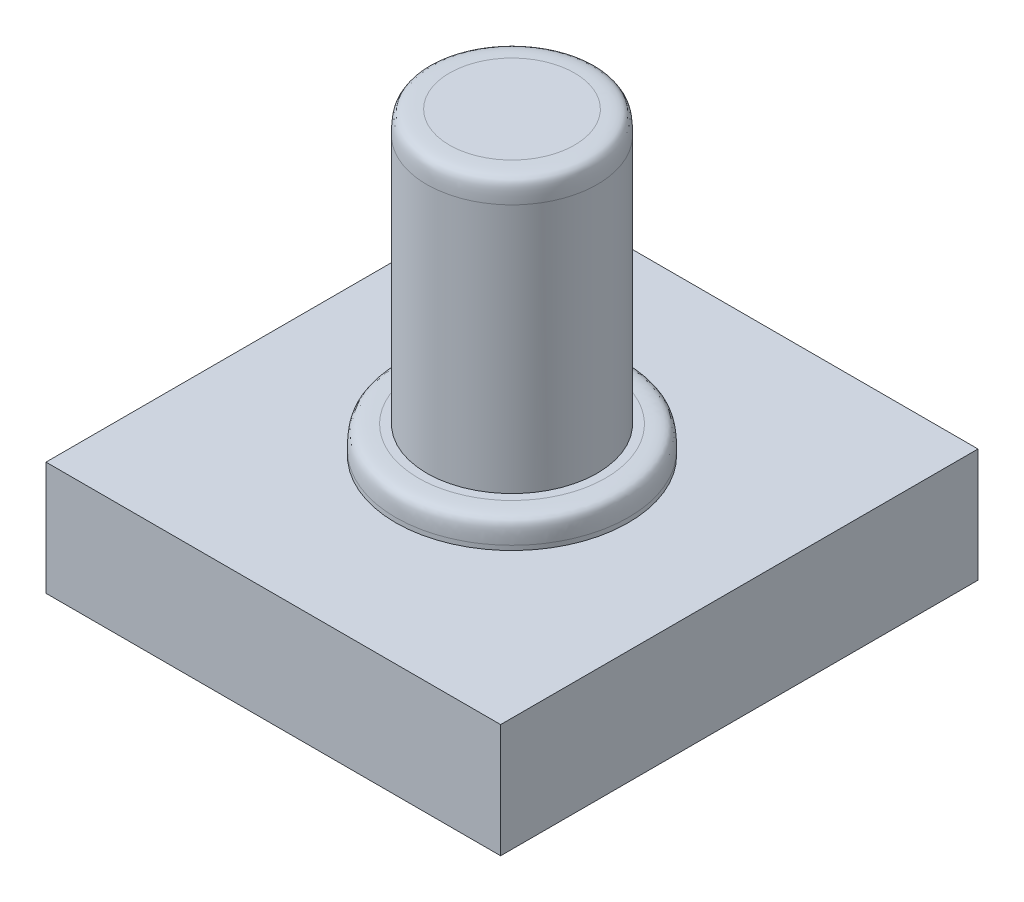
from build123d import *

# Parameters (mm, degrees)
SKETCH_2_W      = 10
SKETCH_2_H      = 10.5
EXTRUDE_1_DEPTH = 2.5
SKETCH_3_R      = 2.56
EXTRUDE_2_DEPTH = 0.6
FILLET_1_SIZE   = 0.5
SKETCH_4_R      = 1.875
EXTRUDE_3_DEPTH = 6
FILLET_2_SIZE   = 0.5


with BuildPart() as part:
    # Эскиз2 → Бобышка-Вытянуть1 (new body)
    with BuildSketch(Plane(origin=(0, 0, 0), x_dir=(1, 0, 0), z_dir=(0, 1, 0))):
        Rectangle(SKETCH_2_W, SKETCH_2_H)
    extrude(amount=EXTRUDE_1_DEPTH)

    # Эскиз3 → Бобышка-Вытянуть2 (add)
    with BuildSketch(Plane(origin=(0, 2.5, 0), x_dir=(1, 0, 0), z_dir=(0, 1, 0))):
        with Locations(Location((0, 0, 0), (0, 0, 270))):
            Circle(SKETCH_3_R)
    extrude(amount=EXTRUDE_2_DEPTH)

    # Скругление1
    # a fillet whose section is not a circle: 0.5 mm, written as the material it takes off along each edge
    with BuildSketch(Plane(origin=(0, 3.1, 0), x_dir=(0, 0, 1), z_dir=(-1, 0, 0))) as fillet_1_piece_1:
        with BuildLine():
            Bezier((2.56, -FILLET_1_SIZE), (2.56, 0), (2.56 - FILLET_1_SIZE, 0), weights=[1, 2.333333333, 1])
            Line((2.56 - FILLET_1_SIZE, 0), (2.56, 0))
            Line((2.56, 0), (2.56, -FILLET_1_SIZE))
        make_face()
    revolve(axis=Axis((0, 3.1, 0), (0, 1, 0)), mode=Mode.SUBTRACT)

    # Эскиз4 → Бобышка-Вытянуть3 (add)
    with BuildSketch(Plane(origin=(0, 3.1, 0), x_dir=(1, 0, 0), z_dir=(0, 1, 0))):
        with Locations(Location((0, 0, 0), (0, 0, 270))):
            Circle(SKETCH_4_R)
    extrude(amount=EXTRUDE_3_DEPTH)

    # Скругление2
    # a fillet whose section is not a circle: 0.5 mm, written as the material it takes off along each edge
    with BuildSketch(Plane(origin=(0, 9.1, 0), x_dir=(0, 0, 1), z_dir=(-1, 0, 0))) as fillet_2_piece_1:
        with BuildLine():
            Bezier((1.875, -FILLET_2_SIZE), (1.875, 0), (1.875 - FILLET_2_SIZE, 0), weights=[1, 2.333333333, 1])
            Line((1.875 - FILLET_2_SIZE, 0), (1.875, 0))
            Line((1.875, 0), (1.875, -FILLET_2_SIZE))
        make_face()
    revolve(axis=Axis((0, 9.1, 0), (0, 1, 0)), mode=Mode.SUBTRACT)


solid = part.part
